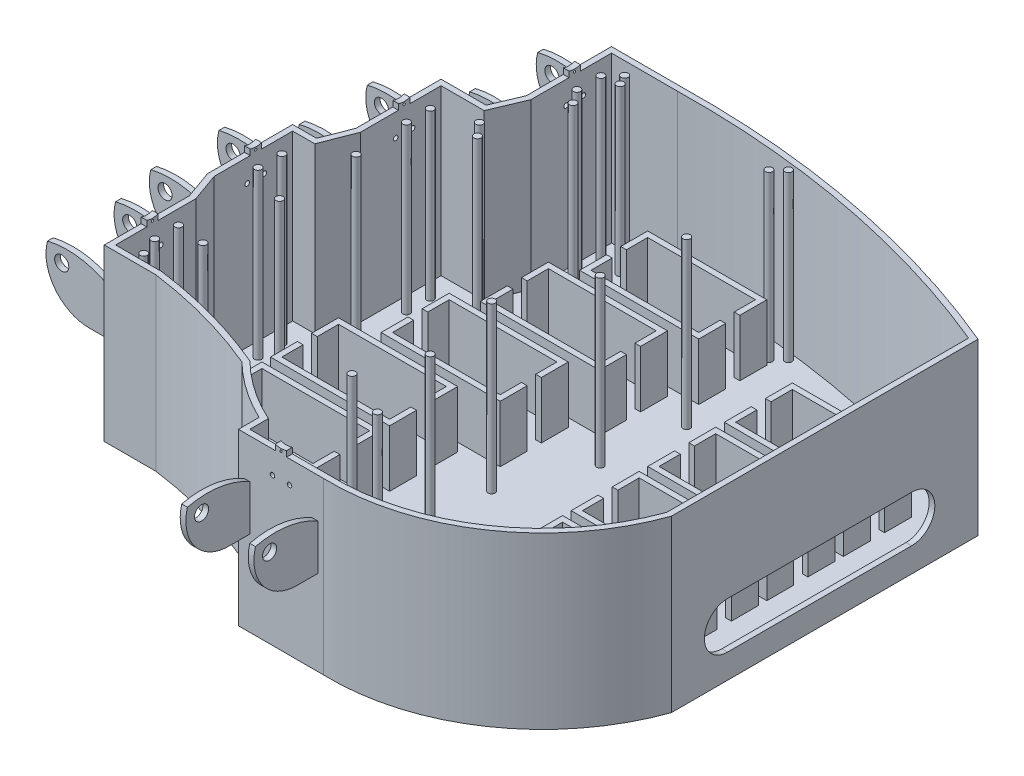
from build123d import *

# Parameters (mm, degrees)
BOSS_EXTRUDE1_DEPTH                = 38.1
CUT_EXTRUDE1_DEPTH                 = 36.83
BOSS_EXTRUDE2_DEPTH                = 13.97
BOSS_EXTRUDE3_DEPTH                = 13.97
BOSS_EXTRUDE4_DEPTH                = 13.97
BOSS_EXTRUDE5_DEPTH                = 13.97
BOSS_EXTRUDE6_DEPTH                = 13.97
BOSS_EXTRUDE7_DEPTH                = 13.97
BOSS_EXTRUDE8_DEPTH                = 13.97
BOSS_EXTRUDE9_DEPTH                = 13.97
BOSS_EXTRUDE10_DEPTH               = 13.97
BOSS_EXTRUDE11_DEPTH               = 13.97
SKETCH25_R                         = 0.508
THUMB_HOLES_DEPTH                  = 12.7
SKETCH31_R                         = 0.508
INDEX_FINGER_HOLES_DEPTH           = 17.018
SKETCH32_R                         = 0.508
MIDDLE_FINGER_HOLES_DEPTH          = 15.24
SKETCH33_R                         = 0.508
RING_FINGER_HOLES_DEPTH            = 22.86
SKETCH34_R                         = 0.508
PINKY_FINGER_HOLES_DEPTH           = 35.56
SKETCH26_R                         = 0.79375
GUIDE_POLES_DEPTH                  = 36.83
SKETCH35_R                         = 1.5875
PINKY_ATTACHMENT_DEPTH             = 19.05
SKETCH36_R                         = 1.5875
RING_ATTACHMENT_DEPTH              = 19.05
SKETCH37_R                         = 1.5875
MIDDLE_ATTACHMENT_DEPTH            = 19.05
SKETCH38_R                         = 1.5875
POINTER_ATTACHMENT_DEPTH           = 19.05
SKETCH39_R                         = 1.5875
THUMB_ATTACHMENT_DEPTH             = 19.05
ATTACHMENT_TRIM_DEPTH              = 25.4
CORD_HOLE_DEPTH                    = 5.08
SKETCH42_W                         = 1.27
SKETCH42_H                         = 2.54
SKETCH42_W_2                       = 2.54
SKETCH42_H_2                       = 1.27
LINE_CONNECTORS_ON_HAND_EDGE_DEPTH = 1.27
SKETCH43_R                         = 0.254
FINGER_LINE_CONNECTOR_CUT_DEPTH    = 50.8
SKETCH44_R                         = 0.254
THUMB_LINE_CONNECTOR_CUT_DEPTH     = 12.7


with BuildPart() as part:
    # Sketch2 → Boss-Extrude1 (new body)
    with BuildSketch(Plane(origin=(0, 0, 0), x_dir=(1, 0, 0), z_dir=(0, 1, 0))):
        with BuildLine():
            Line((-20.778406205, 52.758673202), (-36.188953289, 52.758673202))
            Line((-36.188953289, 52.758673202), (-36.188953289, 33.708673202))
            Line((-36.188953289, 33.708673202), (-38.864171838, 27.358673202))
            Line((-38.864171838, 27.358673202), (-48.947687906, 27.358673202))
            Line((-48.947687906, 27.358673202), (-48.947687906, 8.308673202))
            Line((-48.947687906, 8.308673202), (-51.417120413, 1.958673202))
            Line((-51.417120413, 1.958673202), (-56.767557511, 1.958673202))
            Line((-56.767557511, 1.958673202), (-56.767557511, -17.091326798))
            Line((-56.767557511, -17.091326798), (-54.503911047, -23.441326798))
            Line((-54.503911047, -23.441326798), (-54.503911047, -42.491326798))
            Line((-54.503911047, -42.491326798), (-42.959403849, -42.491326798))
            ThreePointArc((-42.959403849, -42.491326798), (-29.448791922, -45.239401215), (-16.422067996, -49.755263412))
            ThreePointArc((-16.422067996, -49.755263412), (-10.441569813, -54.6928899), (-3.738179712, -58.593027718))
            Line((-3.738179712, -58.593027718), (-3.738179712, -63.210333869))
            Line((-3.738179712, -63.210333869), (15.311820288, -63.210333869))
            ThreePointArc((15.311820288, -63.210333869), (43.592945253, -54.934630767), (61.572422141, -31.588374066))
            Line((61.572422141, -31.588374066), (61.572422141, 37.055318004))
            ThreePointArc((61.572422141, 37.055318004), (21.220515188, 49.225595088), (-20.778406205, 52.758673202))
        make_face()
    extrude(amount=BOSS_EXTRUDE1_DEPTH)

    # Sketch3 → Cut-Extrude1 (cut)
    with BuildSketch(Plane(origin=(0, 38.1, 0), x_dir=(1, 0, 0), z_dir=(0, 1, 0))):
        with BuildLine():
            Line((-20.193208334, 51.499667825), (-34.918953289, 51.499667825))
            Line((-34.918953289, 51.499667825), (-34.918953289, 33.452072477))
            Line((-34.918953289, 33.452072477), (-38.021111135, 26.088673202))
            Line((-38.021111135, 26.088673202), (-47.677687906, 26.088673202))
            Line((-47.677687906, 26.088673202), (-47.677687906, 8.070420839))
            Line((-47.677687906, 8.070420839), (-50.548353666, 0.688673202))
            Line((-50.548353666, 0.688673202), (-55.497557511, 0.688673202))
            Line((-55.497557511, 0.688673202), (-55.497557511, -16.871730038))
            Line((-55.497557511, -16.871730038), (-53.233911047, -23.221730038))
            Line((-53.233911047, -23.221730038), (-53.233911047, -41.221326798))
            Line((-53.233911047, -41.221326798), (-42.874353316, -41.221326798))
            ThreePointArc((-42.874353316, -41.221326798), (-29.038510393, -44.035017068), (-15.705342229, -48.67980221))
            ThreePointArc((-15.705342229, -48.67980221), (-9.484723257, -53.810670952), (-2.468179712, -57.784338167))
            Line((-2.468179712, -57.784338167), (-2.468179712, -61.940333869))
            Line((-2.468179712, -61.940333869), (15.331165443, -61.940333869))
            ThreePointArc((15.331165443, -61.940333869), (42.778545869, -53.952784334), (60.302422141, -31.367979704))
            Line((60.302422141, -31.367979704), (60.302422141, 36.20914612))
            ThreePointArc((60.302422141, 36.20914612), (20.842965823, 48.004654395), (-20.193208334, 51.499667825))
        make_face()
    extrude(amount=-CUT_EXTRUDE1_DEPTH, mode=Mode.SUBTRACT)

    # Sketch6 → Boss-Extrude2 (add)
    with BuildSketch(Plane(origin=(0, 0, 0), x_dir=(1, 0, 0), z_dir=(0, 1, 0))):
        Polygon((-38.295888343, -32.597001669), (-37.025888343, -32.597001669), (-37.025888343, -37.359501669), (-12.895888343, -37.359501669), (-12.895888343, -32.597001669), (-11.625888343, -32.597001669), (-11.625888343, -38.629501669), (-38.295888343, -38.629501669), align=None)
        Polygon((-12.895888343, -24.659501669), (-37.025888343, -24.659501669), (-37.025888343, -29.422001669), (-38.295888343, -29.422001669), (-38.295888343, -23.389501669), (-11.625888343, -23.389501669), (-11.625888343, -29.422001669), (-12.895888343, -29.422001669), align=None)
    extrude(amount=BOSS_EXTRUDE2_DEPTH)

    # Sketch7 → Boss-Extrude3 (add)
    with BuildSketch(Plane(origin=(0, 0, 0), x_dir=(1, 0, 0), z_dir=(0, 1, 0))):
        Polygon((-38.295888343, -15.452001669), (-37.025888343, -15.452001669), (-37.025888343, -20.214501669), (-12.895888343, -20.214501669), (-12.895888343, -15.452001669), (-11.625888343, -15.452001669), (-11.625888343, -21.484501669), (-38.295888343, -21.484501669), align=None)
        Polygon((-12.895888343, -7.514501669), (-37.025888343, -7.514501669), (-37.025888343, -12.277001669), (-38.295888343, -12.277001669), (-38.295888343, -6.244501669), (-11.625888343, -6.244501669), (-11.625888343, -12.277001669), (-12.895888343, -12.277001669), align=None)
    extrude(amount=BOSS_EXTRUDE3_DEPTH)

    # Sketch15 → Boss-Extrude4 (add)
    with BuildSketch(Plane.XZ):
        Polygon((-30.675888343, -4.867998331), (-29.405888343, -4.867998331), (-29.405888343, -9.630498331), (-5.275888343, -9.630498331), (-5.275888343, -4.867998331), (-4.005888343, -4.867998331), (-4.005888343, -10.900498331), (-30.675888343, -10.900498331), align=None)
        Polygon((-5.275888343, 3.069501669), (-29.405888343, 3.069501669), (-29.405888343, -1.692998331), (-30.675888343, -1.692998331), (-30.675888343, 4.339501669), (-4.005888343, 4.339501669), (-4.005888343, -1.692998331), (-5.275888343, -1.692998331), align=None)
    extrude(amount=-BOSS_EXTRUDE4_DEPTH)

    # Sketch16 → Boss-Extrude5 (add)
    with BuildSketch(Plane.XZ):
        Polygon((-25.595888343, -22.012998331), (-24.325888343, -22.012998331), (-24.325888343, -26.775498331), (-0.195888343, -26.775498331), (-0.195888343, -22.012998331), (1.074111657, -22.012998331), (1.074111657, -28.045498331), (-25.595888343, -28.045498331), align=None)
        Polygon((-0.195888343, -14.075498331), (-24.325888343, -14.075498331), (-24.325888343, -18.837998331), (-25.595888343, -18.837998331), (-25.595888343, -12.805498331), (1.074111657, -12.805498331), (1.074111657, -18.837998331), (-0.195888343, -18.837998331), align=None)
    extrude(amount=-BOSS_EXTRUDE5_DEPTH)

    # Sketch17 → Boss-Extrude6 (add)
    with BuildSketch(Plane.XZ):
        Polygon((-20.515888343, -39.157998331), (-19.245888343, -39.157998331), (-19.245888343, -43.920498331), (4.884111657, -43.920498331), (4.884111657, -39.157998331), (6.154111657, -39.157998331), (6.154111657, -45.190498331), (-20.515888343, -45.190498331), align=None)
        Polygon((4.884111657, -31.220498331), (-19.245888343, -31.220498331), (-19.245888343, -35.982998331), (-20.515888343, -35.982998331), (-20.515888343, -29.950498331), (6.154111657, -29.950498331), (6.154111657, -35.982998331), (4.884111657, -35.982998331), align=None)
    extrude(amount=-BOSS_EXTRUDE6_DEPTH)

    # Sketch18 → Boss-Extrude7 (add)
    with BuildSketch(Plane.XZ):
        Polygon((14.980982224, 42.694916505), (16.250982224, 42.694916505), (16.250982224, 37.932416505), (40.380982224, 37.932416505), (40.380982224, 42.694916505), (41.650982224, 42.694916505), (41.650982224, 36.662416505), (14.980982224, 36.662416505), align=None)
        Polygon((40.380982224, 50.632416505), (16.250982224, 50.632416505), (16.250982224, 45.869916505), (14.980982224, 45.869916505), (14.980982224, 51.902416505), (41.650982224, 51.902416505), (41.650982224, 45.869916505), (40.380982224, 45.869916505), align=None)
    extrude(amount=-BOSS_EXTRUDE7_DEPTH)

    # Sketch19 → Boss-Extrude8 (add)
    with BuildSketch(Plane.XZ):
        Polygon((25.140982224, 25.549916505), (26.410982224, 25.549916505), (26.410982224, 20.787416505), (50.540982224, 20.787416505), (50.540982224, 25.549916505), (51.810982224, 25.549916505), (51.810982224, 19.517416505), (25.140982224, 19.517416505), align=None)
        Polygon((50.540982224, 33.487416505), (26.410982224, 33.487416505), (26.410982224, 28.724916505), (25.140982224, 28.724916505), (25.140982224, 34.757416505), (51.810982224, 34.757416505), (51.810982224, 28.724916505), (50.540982224, 28.724916505), align=None)
    extrude(amount=-BOSS_EXTRUDE8_DEPTH)

    # Sketch20 → Boss-Extrude9 (add)
    with BuildSketch(Plane.XZ):
        Polygon((25.140982224, 8.404916505), (26.410982224, 8.404916505), (26.410982224, 3.642416505), (50.540982224, 3.642416505), (50.540982224, 8.404916505), (51.810982224, 8.404916505), (51.810982224, 2.372416505), (25.140982224, 2.372416505), align=None)
        Polygon((50.540982224, 16.342416505), (26.410982224, 16.342416505), (26.410982224, 11.579916505), (25.140982224, 11.579916505), (25.140982224, 17.612416505), (51.810982224, 17.612416505), (51.810982224, 11.579916505), (50.540982224, 11.579916505), align=None)
    extrude(amount=-BOSS_EXTRUDE9_DEPTH)

    # Sketch21 → Boss-Extrude10 (add)
    with BuildSketch(Plane.XZ):
        Polygon((25.140982224, -8.740083495), (26.410982224, -8.740083495), (26.410982224, -13.502583495), (50.540982224, -13.502583495), (50.540982224, -8.740083495), (51.810982224, -8.740083495), (51.810982224, -14.772583495), (25.140982224, -14.772583495), align=None)
        Polygon((50.540982224, -0.802583495), (26.410982224, -0.802583495), (26.410982224, -5.565083495), (25.140982224, -5.565083495), (25.140982224, 0.467416505), (51.810982224, 0.467416505), (51.810982224, -5.565083495), (50.540982224, -5.565083495), align=None)
    extrude(amount=-BOSS_EXTRUDE10_DEPTH)

    # Sketch22 → Boss-Extrude11 (add)
    with BuildSketch(Plane.XZ):
        Polygon((25.140982224, -25.885083495), (26.410982224, -25.885083495), (26.410982224, -30.647583495), (50.540982224, -30.647583495), (50.540982224, -25.885083495), (51.810982224, -25.885083495), (51.810982224, -31.917583495), (25.140982224, -31.917583495), align=None)
        Polygon((50.540982224, -17.947583495), (26.410982224, -17.947583495), (26.410982224, -22.710083495), (25.140982224, -22.710083495), (25.140982224, -16.677583495), (51.810982224, -16.677583495), (51.810982224, -22.710083495), (50.540982224, -22.710083495), align=None)
    extrude(amount=-BOSS_EXTRUDE11_DEPTH)

    # Sketch25 → Thumb Holes (cut)
    with BuildSketch(Plane.XY.offset(63.5)):
        with Locations((7.691820288, 33.02)):
            Circle(SKETCH25_R)
        with Locations((3.881820288, 33.02)):
            Circle(SKETCH25_R)
    extrude(amount=-THUMB_HOLES_DEPTH, mode=Mode.SUBTRACT)

    # Sketch31 → Index Finger Holes (cut)
    with BuildSketch(Plane(origin=(-69.85, 0, 0), x_dir=(0, 0, -1), z_dir=(1, 0, 0))):
        with Locations((-31.061326798, 33.02)):
            Circle(SKETCH31_R)
        with Locations((-34.871326798, 33.02)):
            Circle(SKETCH31_R)
    extrude(amount=INDEX_FINGER_HOLES_DEPTH, mode=Mode.SUBTRACT)

    # Sketch32 → Middle Finger Holes (cut)
    with BuildSketch(Plane(origin=(-69.85, 0, 0), x_dir=(0, 0, -1), z_dir=(1, 0, 0))):
        with Locations((-9.471326798, 33.02)):
            Circle(SKETCH32_R)
        with Locations((-5.661326798, 33.02)):
            Circle(SKETCH32_R)
    extrude(amount=MIDDLE_FINGER_HOLES_DEPTH, mode=Mode.SUBTRACT)

    # Sketch33 → Ring Finger Holes (cut)
    with BuildSketch(Plane(origin=(-69.85, 0, 0), x_dir=(0, 0, -1), z_dir=(1, 0, 0))):
        with Locations((15.928673202, 33.02)):
            Circle(SKETCH33_R)
        with Locations((19.738673202, 33.02)):
            Circle(SKETCH33_R)
    extrude(amount=RING_FINGER_HOLES_DEPTH, mode=Mode.SUBTRACT)

    # Sketch34 → Pinky Finger Holes (cut)
    with BuildSketch(Plane(origin=(-69.85, 0, 0), x_dir=(0, 0, -1), z_dir=(1, 0, 0))):
        with Locations((41.328673202, 33.02)):
            Circle(SKETCH34_R)
        with Locations((45.181435651, 33.02)):
            Circle(SKETCH34_R)
    extrude(amount=PINKY_FINGER_HOLES_DEPTH, mode=Mode.SUBTRACT)

    # Sketch26 → Guide Poles (add)
    with BuildSketch(Plane(origin=(0, 38.1, 0), x_dir=(1, 0, 0), z_dir=(0, 1, 0))):
        with Locations((8.453820288, -44.282416505)):
            Circle(SKETCH26_R)
        with Locations((3.119820288, -27.137416505)):
            Circle(SKETCH26_R)
        with Locations((-0.26286752, -9.992416505)):
            Circle(SKETCH26_R)
        with Locations((6.891203923, 7.152583495)):
            Circle(SKETCH26_R)
        with Locations((9.098692406, 24.297583495)):
            Circle(SKETCH26_R)
        with Locations((-1.85036752, -39.675840032)):
            Circle(SKETCH26_R)
        with Locations((7.511192406, 48.675794749)):
            Circle(SKETCH26_R)
        with Locations((5.303703923, 46.519643207)):
            Circle(SKETCH26_R)
        with Locations((-48.471411047, -39.675840032)):
            Circle(SKETCH26_R)
        with Locations((-52.322557511, -10.233326798)):
            Circle(SKETCH26_R)
        with Locations((-52.322557511, -4.899326798)):
            Circle(SKETCH26_R)
        with Locations((-43.893096038, -13.864501669)):
            Circle(SKETCH26_R)
        with Locations((-43.893096038, 3.280498331)):
            Circle(SKETCH26_R)
        with Locations((-33.874140009, 20.425498331)):
            Circle(SKETCH26_R)
        with Locations((-44.502687906, 15.166673202)):
            Circle(SKETCH26_R)
        with Locations((-29.603786365, 37.570498331)):
            Circle(SKETCH26_R)
        with Locations((-36.306573109, 23.2953928)):
            Circle(SKETCH26_R)
        with Locations((-44.502687906, 20.500673202)):
            Circle(SKETCH26_R)
        with Locations((-28.009949736, 46.519643207)):
            Circle(SKETCH26_R)
        with Locations((-29.153323684, 48.675794749)):
            Circle(SKETCH26_R)
        with Locations((-31.743953289, 40.566673202)):
            Circle(SKETCH26_R)
        with Locations((-31.743953289, 45.943435651)):
            Circle(SKETCH26_R)
        with Locations((-50.058911047, -35.633326798)):
            Circle(SKETCH26_R)
        with Locations((-50.058911047, -30.299326798)):
            Circle(SKETCH26_R)
        with Locations((-43.893096038, -31.009501669)):
            Circle(SKETCH26_R)
    extrude(amount=-GUIDE_POLES_DEPTH)

    # Sketch35 → Pinky Attachment (add)
    with BuildSketch(Plane(origin=(0, 0, -52.758673202), x_dir=(-1, 0, 0), z_dir=(0, 0, -1))):
        with BuildLine():
            Line((36.188953289, 19.05), (40.633953289, 19.05))
            ThreePointArc((40.633953289, 19.05), (48.453817359, 22.75743432), (50.158953289, 31.242))
            ThreePointArc((50.158953289, 31.242), (42.978780551, 31.567812574), (36.188953289, 29.21))
            Line((36.188953289, 29.21), (36.188953289, 19.05))
        make_face()
        with Locations((46.983953289, 28.575)):
            Circle(SKETCH35_R, mode=Mode.SUBTRACT)
    extrude(amount=-PINKY_ATTACHMENT_DEPTH)

    # Sketch36 → Ring Attachment (add)
    with BuildSketch(Plane(origin=(0, 0, -27.358673202), x_dir=(-1, 0, 0), z_dir=(0, 0, -1))):
        with BuildLine():
            Line((48.947687906, 29.21), (48.947687906, 19.05))
            Line((48.947687906, 19.05), (53.392687906, 19.05))
            ThreePointArc((53.392687906, 19.05), (61.212551977, 22.75743432), (62.917687906, 31.242))
            ThreePointArc((62.917687906, 31.242), (55.737515168, 31.567812574), (48.947687906, 29.21))
        make_face()
        with Locations((59.742687906, 28.707395517)):
            Circle(SKETCH36_R, mode=Mode.SUBTRACT)
    extrude(amount=-RING_ATTACHMENT_DEPTH)

    # Sketch37 → Middle Attachment (add)
    with BuildSketch(Plane(origin=(0, 0, -1.958673202), x_dir=(-1, 0, 0), z_dir=(0, 0, -1))):
        with BuildLine():
            Line((56.767557511, 29.21), (56.767557511, 19.05))
            Line((56.767557511, 19.05), (61.212557511, 19.05))
            ThreePointArc((61.212557511, 19.05), (69.032421581, 22.75743432), (70.737557511, 31.242))
            ThreePointArc((70.737557511, 31.242), (63.557384773, 31.567812574), (56.767557511, 29.21))
        make_face()
        with Locations((67.562557511, 28.575)):
            Circle(SKETCH37_R, mode=Mode.SUBTRACT)
    extrude(amount=-MIDDLE_ATTACHMENT_DEPTH)

    # Sketch38 → Pointer Attachment (add)
    with BuildSketch(Plane(origin=(0, 0, 23.441326798), x_dir=(-1, 0, 0), z_dir=(0, 0, -1))):
        with BuildLine():
            Line((58.948911047, 19.05), (54.503911047, 19.05))
            Line((54.503911047, 19.05), (54.503911047, 29.21))
            ThreePointArc((54.503911047, 29.21), (61.293738309, 31.567812574), (68.473911047, 31.242))
            ThreePointArc((68.473911047, 31.242), (66.768775117, 22.75743432), (58.948911047, 19.05))
        make_face()
        with Locations((65.298911047, 28.575)):
            Circle(SKETCH38_R, mode=Mode.SUBTRACT)
    extrude(amount=-POINTER_ATTACHMENT_DEPTH)

    # Sketch39 → Thumb Attachment (add)
    with BuildSketch(Plane.ZY.offset(3.738179712)):
        with BuildLine():
            Line((63.210333869, 19.05), (67.655333869, 19.05))
            ThreePointArc((67.655333869, 19.05), (75.475197939, 22.75743432), (77.180333869, 31.242))
            ThreePointArc((77.180333869, 31.242), (70.000161131, 31.567812574), (63.210333869, 29.21))
            Line((63.210333869, 29.21), (63.210333869, 19.05))
        make_face()
        with Locations((74.005333869, 28.575)):
            Circle(SKETCH39_R, mode=Mode.SUBTRACT)
    extrude(amount=-THUMB_ATTACHMENT_DEPTH)

    # Sketch40 → Attachment Trim (cut)
    with BuildSketch(Plane(origin=(0, 38.1, 0), x_dir=(1, 0, 0), z_dir=(0, 1, 0))):
        with BuildLine():
            Line((-1.198179712, -63.210333869), (12.771820288, -63.210333869))
            Line((12.771820288, -63.210333869), (12.771820288, -78.53587148))
            Line((12.771820288, -78.53587148), (14.041820288, -78.53587148))
            Line((14.041820288, -78.53587148), (14.041820288, -63.210333869))
            Line((14.041820288, -63.210333869), (15.311820288, -63.210333869))
            ThreePointArc((15.311820288, -63.210333869), (4.445704746, -84.821396352), (-6.420410797, -63.210333869))
            Line((-6.420410797, -63.210333869), (-2.468179712, -63.210333869))
            Line((-2.468179712, -63.210333869), (-2.468179712, -78.478629921))
            Line((-2.468179712, -78.478629921), (-1.198179712, -78.478629921))
            Line((-1.198179712, -78.478629921), (-1.198179712, -63.210333869))
        make_face()
        with BuildLine():
            Line((-54.503911047, -42.491326798), (-54.503911047, -41.221326798))
            Line((-54.503911047, -41.221326798), (-69.450746427, -41.221326798))
            Line((-69.450746427, -41.221326798), (-69.450746427, -39.951326798))
            Line((-69.450746427, -39.951326798), (-54.503911047, -39.951326798))
            Line((-54.503911047, -39.951326798), (-54.503911047, -25.981326798))
            Line((-54.503911047, -25.981326798), (-69.522821924, -25.981326798))
            Line((-69.522821924, -25.981326798), (-69.522821924, -24.711326798))
            Line((-69.522821924, -24.711326798), (-54.503911047, -24.711326798))
            Line((-54.503911047, -24.711326798), (-54.503911047, -23.441326798))
            ThreePointArc((-54.503911047, -23.441326798), (-74.827366982, -32.966326798), (-54.503911047, -42.491326798))
        make_face()
        with BuildLine():
            Line((-56.767557511, -17.091326798), (-56.767557511, -15.821326798))
            Line((-56.767557511, -15.821326798), (-71.425044096, -15.821326798))
            Line((-71.425044096, -15.821326798), (-71.425044096, -14.551326798))
            Line((-71.425044096, -14.551326798), (-56.767557511, -14.551326798))
            Line((-56.767557511, -14.551326798), (-56.767557511, -0.581326798))
            Line((-56.767557511, -0.581326798), (-71.300395146, -0.581326798))
            Line((-71.300395146, -0.581326798), (-71.300395146, 0.688673202))
            Line((-71.300395146, 0.688673202), (-56.767557511, 0.688673202))
            Line((-56.767557511, 0.688673202), (-56.767557511, 1.958673202))
            ThreePointArc((-56.767557511, 1.958673202), (-78.393851178, -7.566326798), (-56.767557511, -17.091326798))
        make_face()
        with BuildLine():
            Line((-48.947687906, 8.308673202), (-48.947687906, 9.578673202))
            Line((-48.947687906, 9.578673202), (-63.81659846, 9.578673202))
            Line((-63.81659846, 9.578673202), (-63.81659846, 10.848673202))
            Line((-63.81659846, 10.848673202), (-48.947687906, 10.848673202))
            Line((-48.947687906, 10.848673202), (-48.947687906, 24.818673202))
            Line((-48.947687906, 24.818673202), (-63.871264763, 24.818673202))
            Line((-63.871264763, 24.818673202), (-63.871264763, 26.088673202))
            Line((-63.871264763, 26.088673202), (-48.947687906, 26.088673202))
            Line((-48.947687906, 26.088673202), (-48.947687906, 27.358673202))
            ThreePointArc((-48.947687906, 27.358673202), (-69.447688873, 17.833673202), (-48.947687906, 8.308673202))
        make_face()
        with BuildLine():
            Line((-36.188953289, 33.708673202), (-36.188953289, 34.978673202))
            Line((-36.188953289, 34.978673202), (-51.878710413, 34.978673202))
            Line((-51.878710413, 34.978673202), (-51.878710413, 36.248673202))
            Line((-51.878710413, 36.248673202), (-36.188953289, 36.248673202))
            Line((-36.188953289, 36.248673202), (-36.188953289, 50.218673202))
            Line((-36.188953289, 50.218673202), (-51.739164497, 50.218673202))
            Line((-51.739164497, 50.218673202), (-51.739164497, 51.488673202))
            Line((-51.739164497, 51.488673202), (-36.188953289, 51.488673202))
            Line((-36.188953289, 51.488673202), (-36.188953289, 52.758673202))
            ThreePointArc((-36.188953289, 52.758673202), (-55.79651108, 43.233673202), (-36.188953289, 33.708673202))
        make_face()
    extrude(amount=-ATTACHMENT_TRIM_DEPTH, mode=Mode.SUBTRACT)

    # Sketch41 → Cord Hole (cut)
    with BuildSketch(Plane(origin=(62.913848002, 0, 0), x_dir=(0, 0, -1), z_dir=(1, 0, 0))):
        with BuildLine():
            Line((-19.01291879, 15.851932983), (22.200875308, 15.851932983))
            ThreePointArc((22.200875308, 15.851932983), (27.393164329, 10.659643963), (22.200875308, 5.467354942))
            Line((22.200875308, 5.467354942), (-19.01291879, 5.467354942))
            ThreePointArc((-19.01291879, 5.467354942), (-24.20520781, 10.659643963), (-19.01291879, 15.851932983))
        make_face()
    extrude(amount=-CORD_HOLE_DEPTH, mode=Mode.SUBTRACT)

    # Sketch42 → Line Connectors on Hand Edge (add)
    with BuildSketch(Plane(origin=(0, 38.1, 0), x_dir=(1, 0, 0), z_dir=(0, 1, 0))):
        with Locations((-35.553953289, 43.233673202)):
            Rectangle(SKETCH42_W, SKETCH42_H)
        with Locations((-48.312687906, 17.833673202)):
            Rectangle(SKETCH42_W, SKETCH42_H)
        with Locations((-56.132557511, -7.566326798)):
            Rectangle(SKETCH42_W, SKETCH42_H)
        with Locations((-53.868911047, -32.966326798)):
            Rectangle(SKETCH42_W, SKETCH42_H)
        with Locations((5.786820288, -62.575333869)):
            Rectangle(SKETCH42_W_2, SKETCH42_H_2)
    extrude(amount=LINE_CONNECTORS_ON_HAND_EDGE_DEPTH)

    # Sketch43 → Finger Line Connector Cut (cut)
    with BuildSketch(Plane(origin=(-69.85, 0, 0), x_dir=(0, 0, -1), z_dir=(1, 0, 0))):
        with Locations((-32.966326798, 38.608)):
            Circle(SKETCH43_R)
        with Locations((-7.566326798, 38.608)):
            Circle(SKETCH43_R)
        with Locations((17.833673202, 38.608)):
            Circle(SKETCH43_R)
        with Locations((43.233673202, 38.608)):
            Circle(SKETCH43_R)
        with BuildLine():
            ThreePointArc((-34.236326798, 39.37), (-32.966326798, 39.152102448), (-31.696326798, 39.37))
            ThreePointArc((-31.696326798, 39.37), (-32.966326798, 39.746489645), (-34.236326798, 39.37))
        make_face()
        with BuildLine():
            ThreePointArc((-8.836326798, 39.37), (-7.566326798, 39.152102448), (-6.296326798, 39.37))
            ThreePointArc((-6.296326798, 39.37), (-7.566326798, 39.786489071), (-8.836326798, 39.37))
        make_face()
        with BuildLine():
            ThreePointArc((16.563673202, 39.37), (17.833673202, 39.152102448), (19.103673202, 39.37))
            ThreePointArc((19.103673202, 39.37), (17.833673202, 39.896051224), (16.563673202, 39.37))
        make_face()
        with BuildLine():
            ThreePointArc((41.963673202, 39.37), (43.233673202, 39.152102448), (44.503673202, 39.37))
            ThreePointArc((44.503673202, 39.37), (43.233673202, 39.679166891), (41.963673202, 39.37))
        make_face()
    extrude(amount=FINGER_LINE_CONNECTOR_CUT_DEPTH, mode=Mode.SUBTRACT)

    # Sketch44 → Thumb Line Connector Cut (cut)
    with BuildSketch(Plane.XY.offset(63.5)):
        with Locations((5.786820288, 38.608)):
            Circle(SKETCH44_R)
        with BuildLine():
            ThreePointArc((7.056820288, 39.37), (5.786820288, 39.152102448), (4.516820288, 39.37))
            ThreePointArc((4.516820288, 39.37), (5.786820288, 39.896051224), (7.056820288, 39.37))
        make_face()
    extrude(amount=-THUMB_LINE_CONNECTOR_CUT_DEPTH, mode=Mode.SUBTRACT)


solid = part.part
